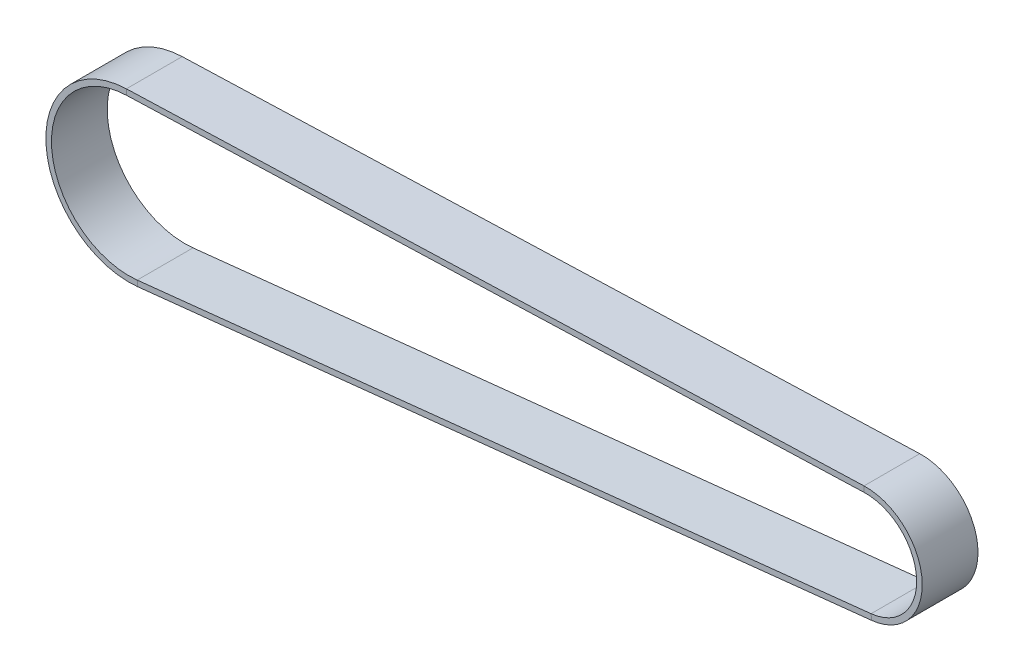
from build123d import *

# Parameters (mm, degrees)
CROQUIS3_W = 10
CROQUIS3_H = 1


with BuildPart() as part:
    # Barrer1: sweep along a path in Croquis2
    with BuildLine(Plane.XY) as barrer1_path:
        Line((0.965224878, -9.078834778), (-130.607144948, -23.067075312))
        ThreePointArc((-130.607144948, -23.067075312), (-145.948280448, -10.210409366), (-132.546701076, 4.657070851))
        Line((-132.546701076, 4.657070851), (-0.308284467, 9.124793734))
        ThreePointArc((-0.308284467, 9.124793734), (9.107739315, 0.637169184), (0.965224878, -9.078834778))
    # Croquis3 → Barrer1 (sweep)
    with BuildSketch(Plane(origin=(-0.308284467, 0, 0), x_dir=(0, 0, -1), z_dir=(1, 0, 0))):
        with Locations((0, 9.624793734)):
            Rectangle(CROQUIS3_W, CROQUIS3_H)
    sweep(path=barrer1_path.line)


solid = part.part
